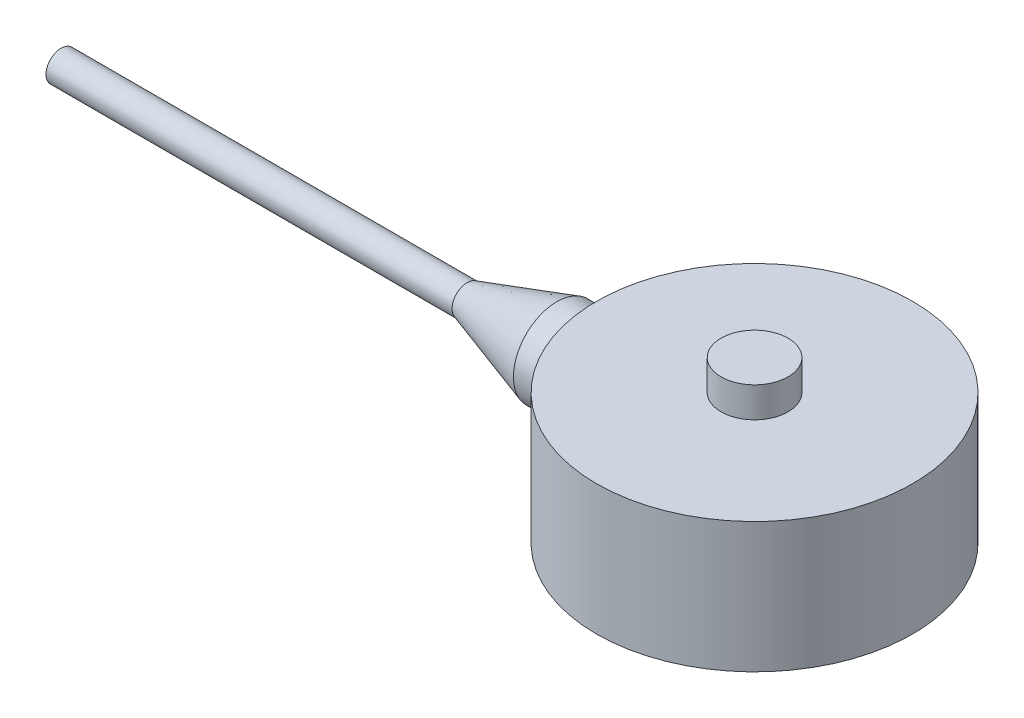
from build123d import *

# Parameters (mm, degrees)
SKETCH1_R    = 25
BASE_DEPTH   = 20.6
SKETCH2_R    = 5.3
BUTTON_DEPTH = 4.8


with BuildPart() as part:
    # Sketch1 → base (new body)
    with BuildSketch(Plane(origin=(0, 0, 0), x_dir=(1, 0, 0), z_dir=(0, 1, 0))):
        Circle(SKETCH1_R)
    extrude(amount=BASE_DEPTH)

    # Sketch2 → button (add)
    with BuildSketch(Plane(origin=(0, 20.6, 0), x_dir=(1, 0, 0), z_dir=(0, 1, 0))):
        Circle(SKETCH2_R)
    extrude(amount=BUTTON_DEPTH)


with BuildPart() as body_2:
    # Sketch3 → cable (revolve)
    with BuildSketch(Plane.XY):
        Polygon((-31.279012818, 17.40458722), (-45.468647839, 12.924548251), (-109.69804637, 12.924548251), (-109.69804637, 10.532444291), (-17.472019008, 10.532444291), (-17.472019008, 17.40458722), (-25, 17.40458722), align=None)
    revolve(axis=Axis((-17.472019008, 10.532444291, 0), (-1, 0, 0)))


solid = Compound([part.part, body_2.part])
